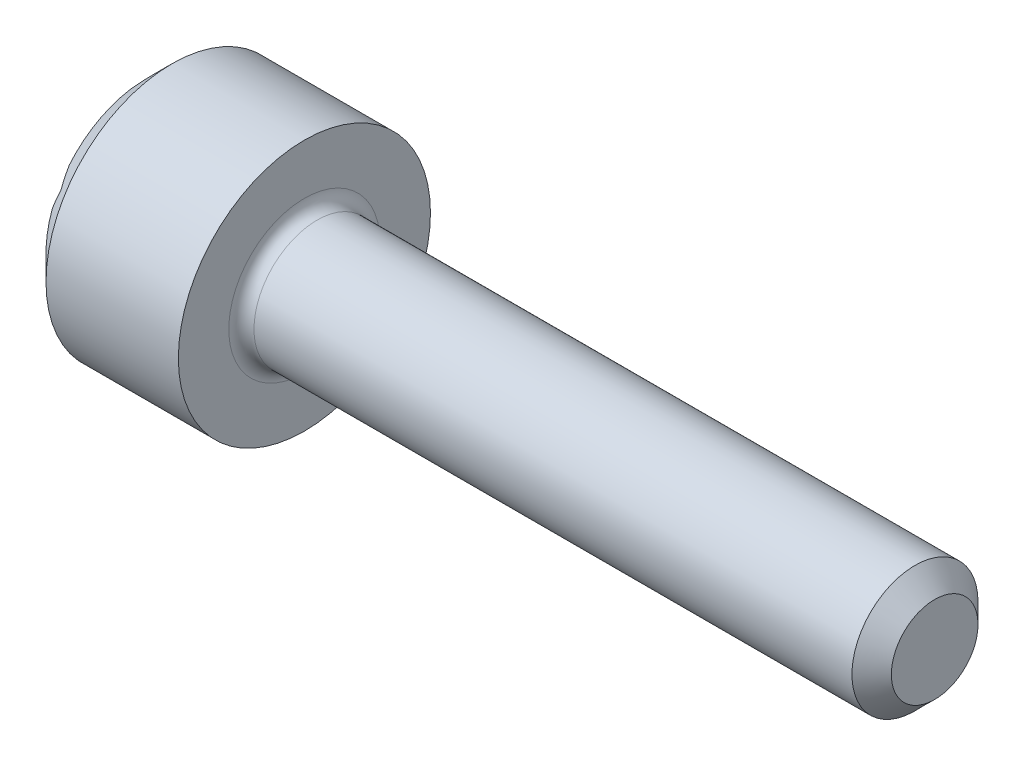
from build123d import *

# Parameters (mm, degrees)
CHAMFER1_SIZE      = 0.625
CUT_EXTRUDE1_DEPTH = 4
CHAMFER2_SIZE      = 0.8
FILLET1_R          = 0.4


with BuildPart() as part:
    # Sketch1 → Revolve1 (revolve)
    with BuildSketch(Plane(origin=(0, 0, 0), x_dir=(1, 0, 0), z_dir=(0, 1, 0))):
        Polygon((0, 0), (0, 4), (5, 4), (5, 2), (25, 2), (25, 0), align=None)
    revolve(axis=Axis((25, 0, 0), (-1, 0, 0)))

    # Chamfer1
    chamfer1_edges = [part.edges().sort_by_distance(p)[0] for p in [
        (25, 0, 2),
    ]]
    chamfer(chamfer1_edges, length=CHAMFER1_SIZE)

    # Sketch3 → Cut-Revolve1 (revolve, cut)
    with BuildSketch(Plane(origin=(0, 0, 0), x_dir=(1, 0, 0), z_dir=(0, 1, 0)), mode=Mode.PRIVATE) as cut_revolve1_sk:
        Polygon((0, 0), (5.732050808, 0), (4, 3), (0, 3), align=None)
    revolve(cut_revolve1_sk.sketch.rotate(Axis((0, 0, 0), (1, 0, 0)), 180), axis=Axis((0, 0, 0), (1, 0, 0)), mode=Mode.SUBTRACT)

    # Sketch2 → Cut-Extrude1 (cut)
    with BuildSketch(Plane.ZY):
        Polygon((0, 3.464101615), (-3, 1.732050808), (-3, -1.732050808), (0, -3.464101615), (3, -1.732050808), (3, 1.732050808), align=None)
    extrude(amount=-CUT_EXTRUDE1_DEPTH, mode=Mode.SUBTRACT)

    # Chamfer2
    # the kernel refuses this chamfer: 0.8 mm, written as the material it takes off along each edge
    with BuildSketch(Plane(origin=(0, 0, 0), x_dir=(0, 0, -1), z_dir=(0, 1, 0))) as chamfer2_piece_1:
        Polygon((4, -CHAMFER2_SIZE), (4 - CHAMFER2_SIZE, 0), (4, 0), align=None)
    revolve(axis=Axis((0, 0, 0), (-1, 0, 0)), mode=Mode.SUBTRACT)

    # Fillet1
    fillet1_edges = [part.edges().sort_by_distance(p)[0] for p in [
        (5, 0, 2),
    ]]
    fillet(fillet1_edges, radius=FILLET1_R)


solid = part.part
